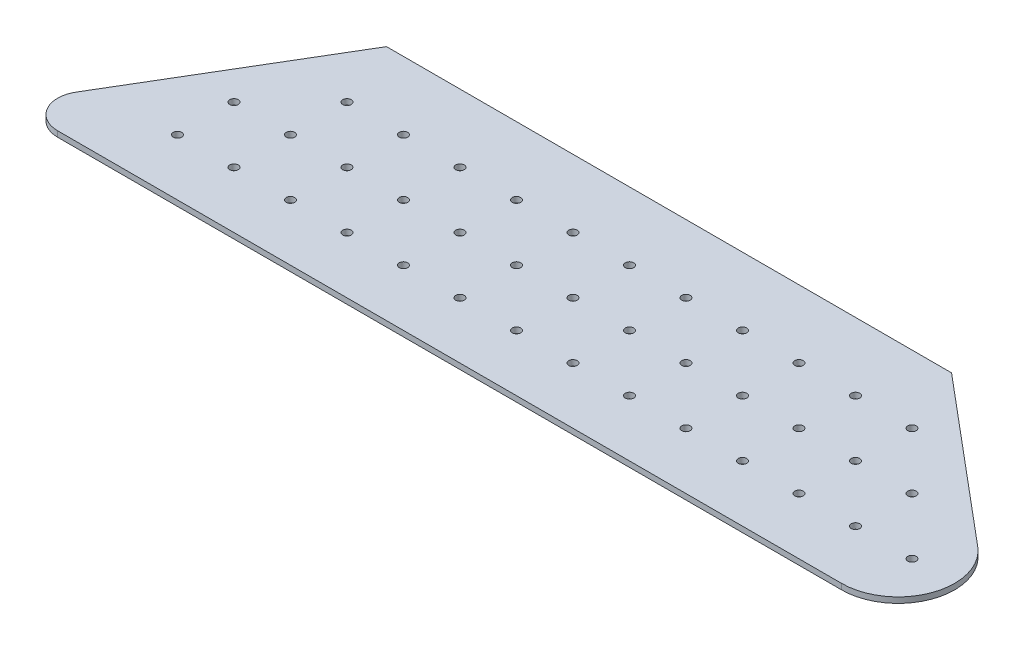
from build123d import *

# Parameters (mm, degrees)
SKETCH1_R           = 1.5
BOSS_EXTRUDE1_DEPTH = 2
FILLET4_R           = 20
FILLET5_R           = 10


with BuildPart() as part:
    # Sketch1 → Boss-Extrude1 (new body)
    with BuildSketch(Plane(origin=(0, 0, 0), x_dir=(1, 0, 0), z_dir=(0, 1, 0))):
        Polygon((-17.984046201, 0), (332.015953799, 0), (232.015953799, 84), (32.015953799, 84), align=None)
        with Locations((42.015953799, 20)):
            Circle(SKETCH1_R, mode=Mode.SUBTRACT)
        with Locations((62.015953799, 20)):
            Circle(SKETCH1_R, mode=Mode.SUBTRACT)
        with Locations((82.015953799, 20)):
            Circle(SKETCH1_R, mode=Mode.SUBTRACT)
        with Locations((102.015953799, 20)):
            Circle(SKETCH1_R, mode=Mode.SUBTRACT)
        with Locations((122.015953799, 20)):
            Circle(SKETCH1_R, mode=Mode.SUBTRACT)
        with Locations((22.015953799, 20)):
            Circle(SKETCH1_R, mode=Mode.SUBTRACT)
        with Locations((162.015953799, 20)):
            Circle(SKETCH1_R, mode=Mode.SUBTRACT)
        with Locations((182.015953799, 20)):
            Circle(SKETCH1_R, mode=Mode.SUBTRACT)
        with Locations((202.015953799, 20)):
            Circle(SKETCH1_R, mode=Mode.SUBTRACT)
        with Locations((222.015953799, 20)):
            Circle(SKETCH1_R, mode=Mode.SUBTRACT)
        with Locations((242.015953799, 20)):
            Circle(SKETCH1_R, mode=Mode.SUBTRACT)
        with Locations((142.015953799, 20)):
            Circle(SKETCH1_R, mode=Mode.SUBTRACT)
        with Locations((242.015953799, 60)):
            Circle(SKETCH1_R, mode=Mode.SUBTRACT)
        with Locations((222.015953799, 60)):
            Circle(SKETCH1_R, mode=Mode.SUBTRACT)
        with Locations((202.015953799, 60)):
            Circle(SKETCH1_R, mode=Mode.SUBTRACT)
        with Locations((182.015953799, 60)):
            Circle(SKETCH1_R, mode=Mode.SUBTRACT)
        with Locations((162.015953799, 60)):
            Circle(SKETCH1_R, mode=Mode.SUBTRACT)
        with Locations((142.015953799, 60)):
            Circle(SKETCH1_R, mode=Mode.SUBTRACT)
        with Locations((122.015953799, 60)):
            Circle(SKETCH1_R, mode=Mode.SUBTRACT)
        with Locations((102.015953799, 60)):
            Circle(SKETCH1_R, mode=Mode.SUBTRACT)
        with Locations((82.015953799, 60)):
            Circle(SKETCH1_R, mode=Mode.SUBTRACT)
        with Locations((62.015953799, 60)):
            Circle(SKETCH1_R, mode=Mode.SUBTRACT)
        with Locations((42.015953799, 60)):
            Circle(SKETCH1_R, mode=Mode.SUBTRACT)
        with Locations((282.015953799, 20)):
            Circle(SKETCH1_R, mode=Mode.SUBTRACT)
        with Locations((262.015953799, 20)):
            Circle(SKETCH1_R, mode=Mode.SUBTRACT)
        with Locations((262.015953799, 40)):
            Circle(SKETCH1_R, mode=Mode.SUBTRACT)
        with Locations((242.015953799, 40)):
            Circle(SKETCH1_R, mode=Mode.SUBTRACT)
        with Locations((202.015953799, 40)):
            Circle(SKETCH1_R, mode=Mode.SUBTRACT)
        with Locations((182.015953799, 40)):
            Circle(SKETCH1_R, mode=Mode.SUBTRACT)
        with Locations((162.015953799, 40)):
            Circle(SKETCH1_R, mode=Mode.SUBTRACT)
        with Locations((142.015953799, 40)):
            Circle(SKETCH1_R, mode=Mode.SUBTRACT)
        with Locations((122.015953799, 40)):
            Circle(SKETCH1_R, mode=Mode.SUBTRACT)
        with Locations((102.015953799, 40)):
            Circle(SKETCH1_R, mode=Mode.SUBTRACT)
        with Locations((82.015953799, 40)):
            Circle(SKETCH1_R, mode=Mode.SUBTRACT)
        with Locations((62.015953799, 40)):
            Circle(SKETCH1_R, mode=Mode.SUBTRACT)
        with Locations((42.015953799, 40)):
            Circle(SKETCH1_R, mode=Mode.SUBTRACT)
        with Locations((22.015953799, 40)):
            Circle(SKETCH1_R, mode=Mode.SUBTRACT)
        with Locations((222.015953799, 40)):
            Circle(SKETCH1_R, mode=Mode.SUBTRACT)
    extrude(amount=BOSS_EXTRUDE1_DEPTH)

    # Fillet4
    fillet4_edges = [part.edges().sort_by_distance(p)[0] for p in [
        (332.015953799, 1, 0),
    ]]
    fillet(fillet4_edges, radius=FILLET4_R)

    # Fillet5
    fillet5_edges = [part.edges().sort_by_distance(p)[0] for p in [
        (-17.984046201, 1, 0),
    ]]
    fillet(fillet5_edges, radius=FILLET5_R)


solid = part.part
